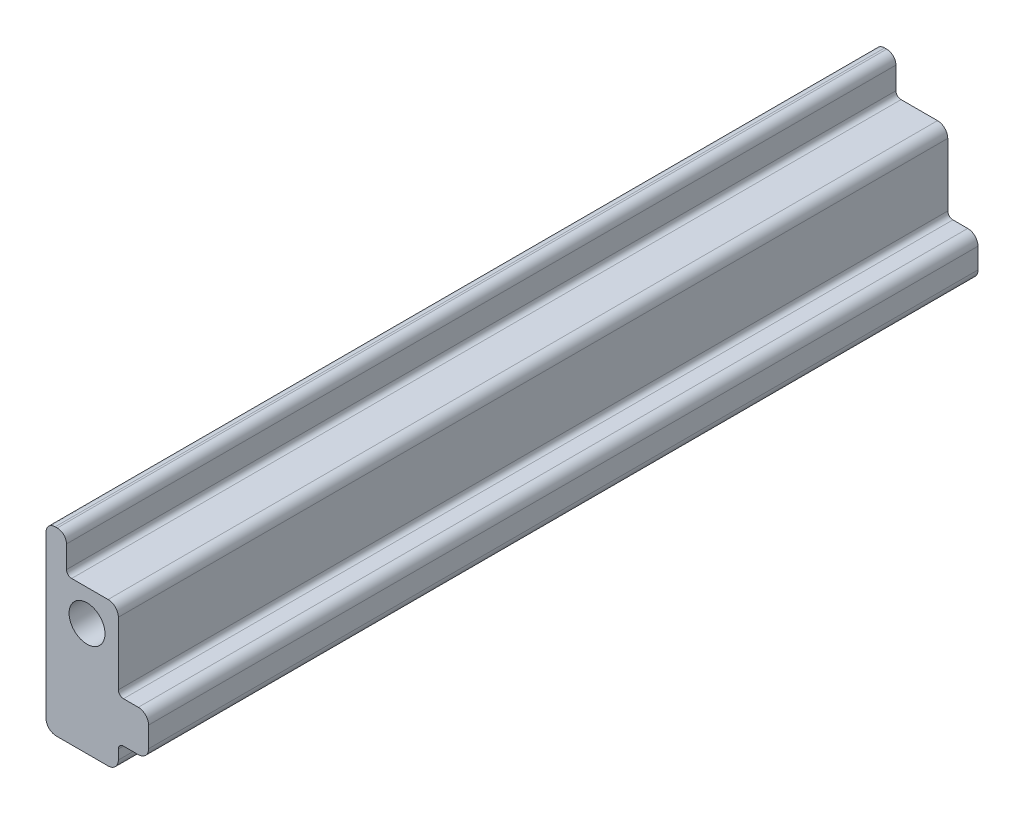
from build123d import *

# Parameters (mm, degrees)
SKETCH1_R           = 11.1125
BOSS_EXTRUDE1_DEPTH = 513.461


with BuildPart() as part:
    # Sketch1 → Boss-Extrude1 (new body)
    with BuildSketch(Plane.XY):
        with BuildLine():
            Line((13.03782, -69.85), (-19.05, -69.85))
            ThreePointArc((-19.05, -69.85), (-23.540128061, -67.990128061), (-25.4, -63.5))
            Line((-25.4, -63.5), (-25.4, 36.297819962))
            ThreePointArc((-25.4, 36.297819962), (-23.726115254, 40.338935216), (-19.685, 42.012819962))
            Line((-19.685, 42.012819962), (-18.415, 42.012819962))
            ThreePointArc((-18.415, 42.012819962), (-14.373884746, 40.338935216), (-12.7, 36.297819962))
            Line((-12.7, 36.297819962), (-12.7, 22.56282))
            ThreePointArc((-12.7, 22.56282), (-11.77006403, 20.31775597), (-9.525, 19.38782))
            Line((-9.525, 19.38782), (13.03782, 19.38782))
            ThreePointArc((13.03782, 19.38782), (17.527948061, 17.527948061), (19.38782, 13.03782))
            Line((19.38782, 13.03782), (19.38782, -25.872179904))
            ThreePointArc((19.38782, -25.872179904), (20.31775597, -28.117243934), (22.56282, -29.047179904))
            Line((22.56282, -29.047179904), (31.75, -29.047179904))
            ThreePointArc((31.75, -29.047179904), (36.240128061, -30.907051843), (38.1, -35.397179904))
            Line((38.1, -35.397179904), (38.1, -48.097179904))
            ThreePointArc((38.1, -48.097179904), (36.240128061, -52.587307965), (31.75, -54.447179904))
            Line((31.75, -54.447179904), (22.56282, -54.447179904))
            ThreePointArc((22.56282, -54.447179904), (20.31775597, -55.377115874), (19.38782, -57.622179904))
            Line((19.38782, -57.622179904), (19.38782, -63.5))
            ThreePointArc((19.38782, -63.5), (17.527948061, -67.990128061), (13.03782, -69.85))
        make_face()
        Circle(SKETCH1_R, mode=Mode.SUBTRACT)
    extrude(amount=BOSS_EXTRUDE1_DEPTH)


solid = part.part
